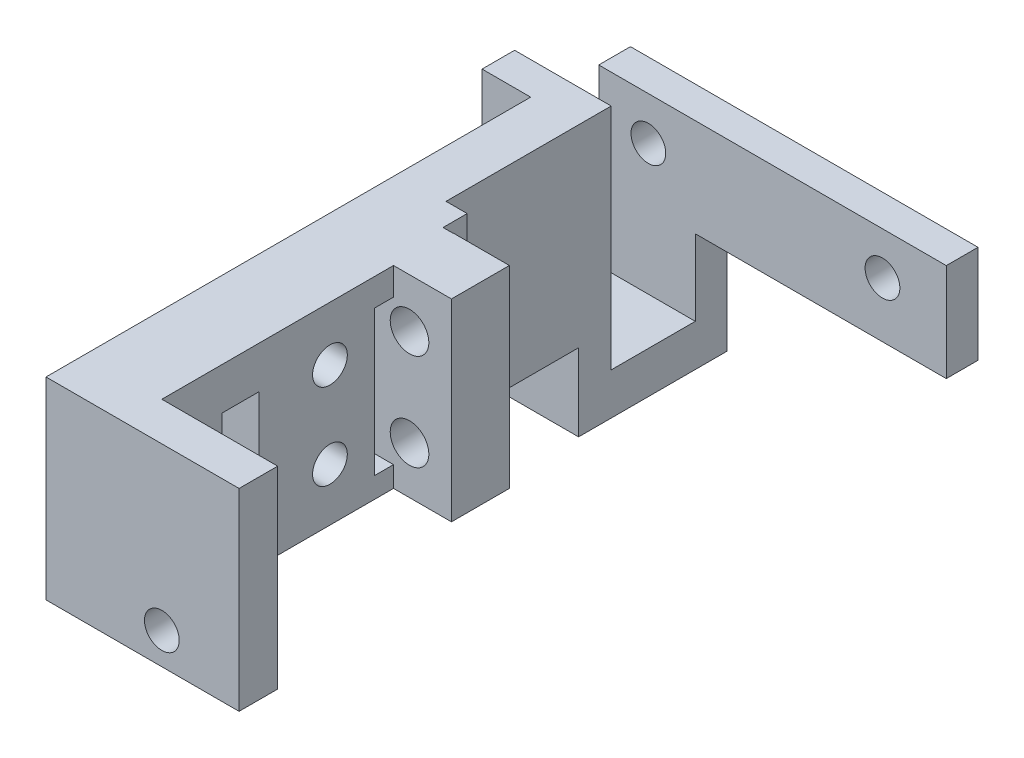
from build123d import *

# Parameters (mm, degrees)
BOSS_EXTRUDE1_DEPTH      = 20
CUT_EXTRUDE1_DEPTH       = 20
SKETCH3_W                = 42.504801082
SKETCH3_H                = 61.271071749
CUT_EXTRUDE2_DEPTH       = 7
BOSS_EXTRUDE3_DEPTH      = 8
BOSS_EXTRUDE3_DEPTH_BACK = 20
SKETCH5_W                = 10
SKETCH5_H                = 3.373015501
SKETCH6_R                = 2
CUT_EXTRUDE3_DEPTH       = 6
SKETCH7_W                = 10
SKETCH7_H                = 4.325701587
BOSS_EXTRUDE4_DEPTH      = 12
SKETCH8_W                = 10
SKETCH8_H                = 3.285099304
BOSS_EXTRUDE5_DEPTH      = 18
SKETCH9_R                = 1.8
CUT_EXTRUDE4_DEPTH       = 20
SKETCH10_W               = 4.6581603
SKETCH10_H               = 5.7
CUT_EXTRUDE5_DEPTH       = 3
SKETCH12_R               = 1.8
CUT_EXTRUDE7_DEPTH       = 5
SKETCH13_R               = 1.8
CUT_EXTRUDE8_DEPTH       = 12
SKETCH14_W               = 3.285099304
SKETCH14_H               = 10.140693855
BOSS_EXTRUDE6_DEPTH      = 26
SKETCH15_R               = 1.8
CUT_EXTRUDE9_DEPTH       = 20
SKETCH16_W               = 1.97268601
SKETCH16_H               = 15.028302634
CUT_EXTRUDE10_DEPTH      = 2
SKETCH18_W               = 3.824807143
SKETCH18_H               = 10.692395384
CUT_EXTRUDE11_DEPTH      = 10


with BuildPart() as part:
    # Sketch1 → Boss-Extrude1 (new body)
    with BuildSketch(Plane(origin=(0, 0, 0), x_dir=(1, 0, 0), z_dir=(0, 1, 0))):
        Polygon((8, 0), (0, 0), (0, -60.58), (20, -60.58), (20, -56.58), (8, -56.58), (8, -32.58), (14, -32.58), (14, -26.58), (8, -26.58), align=None)
    extrude(amount=BOSS_EXTRUDE1_DEPTH)

    # Sketch2 → Cut-Extrude1 (cut)
    with BuildSketch(Plane(origin=(0, 0, 0), x_dir=(-1, 0, 0), z_dir=(0, -1, 0))):
        Polygon((-8, 0), (-8, -26.58), (-8.155800491, -26.58), (-8.155800491, -26.605830214), (-7.155800491, -26.605830214), (-7.155800491, -24.105830214), (-4.963777836, -24.105830214), (-4.963777836, 0), align=None)
    extrude(amount=-CUT_EXTRUDE1_DEPTH, mode=Mode.SUBTRACT)

    # Sketch3 → Cut-Extrude2 (cut)
    with BuildSketch(Plane(origin=(0, 0, 0), x_dir=(-1, 0, 0), z_dir=(0, 0, -1))):
        with Locations((-1.640387793, 8.242348963)):
            Rectangle(SKETCH3_W, SKETCH3_H)
    extrude(amount=-CUT_EXTRUDE2_DEPTH, mode=Mode.SUBTRACT)

    # Sketch5 → Boss-Extrude3 (add, two sides: drawn at the far end of the back side and taken through both)
    with BuildSketch(Plane(origin=(0, 0, 0), x_dir=(-1, 0, 0), z_dir=(0, -1, 0)).offset(-BOSS_EXTRUDE3_DEPTH_BACK)):
        with Locations((0.036222164, -8.686507751)):
            Rectangle(SKETCH5_W, SKETCH5_H)
    extrude(amount=BOSS_EXTRUDE3_DEPTH + BOSS_EXTRUDE3_DEPTH_BACK)

    # Sketch6 → Cut-Extrude3 (cut)
    with BuildSketch(Plane(origin=(0, 0, 26.58), x_dir=(-1, 0, 0), z_dir=(0, 0, -1))):
        with Locations((-9.655800491, 4.904630263)):
            Circle(SKETCH6_R)
        with Locations((-9.655800491, 14.904630263)):
            Circle(SKETCH6_R)
    extrude(amount=-CUT_EXTRUDE3_DEPTH, mode=Mode.SUBTRACT)

    # Sketch7 → Boss-Extrude4 (add)
    with BuildSketch(Plane(origin=(0, 0, 7), x_dir=(-1, 0, 0), z_dir=(0, 0, -1))):
        with Locations((0.036222164, -5.837149207)):
            Rectangle(SKETCH7_W, SKETCH7_H)
    extrude(amount=BOSS_EXTRUDE4_DEPTH)

    # Sketch8 → Boss-Extrude5 (add)
    with BuildSketch(Plane(origin=(0, -3.674298413, 0), x_dir=(1, 0, 0), z_dir=(0, 1, 0))):
        with Locations((-0.036222164, 3.357450348)):
            Rectangle(SKETCH8_W, SKETCH8_H)
    extrude(amount=BOSS_EXTRUDE5_DEPTH)

    # Sketch9 → Cut-Extrude4 (cut)
    with BuildSketch(Plane(origin=(0, 0, -5), x_dir=(-1, 0, 0), z_dir=(0, 0, -1))):
        with Locations((-0.102745826, 9.860584284)):
            Circle(SKETCH9_R)
    extrude(amount=-CUT_EXTRUDE4_DEPTH, mode=Mode.SUBTRACT)

    # Sketch10 → Cut-Extrude5 (cut)
    with BuildSketch(Plane.ZY):
        with Locations((12.702095651, 9.85)):
            Rectangle(SKETCH10_W, SKETCH10_H)
    extrude(amount=-CUT_EXTRUDE5_DEPTH, mode=Mode.SUBTRACT)

    # Sketch12 → Cut-Extrude7 (cut)
    with BuildSketch(Plane.XY.offset(60.58)):
        with Locations((12, 3.26546718)):
            Circle(SKETCH12_R)
    extrude(amount=-CUT_EXTRUDE7_DEPTH, mode=Mode.SUBTRACT)

    # Sketch13 → Cut-Extrude8 (cut)
    with BuildSketch(Plane.ZY):
        with Locations((39.167156573, 5.468808009)):
            Circle(SKETCH13_R)
        with Locations((39.167156573, 14.370824603)):
            Circle(SKETCH13_R)
    extrude(amount=-CUT_EXTRUDE8_DEPTH, mode=Mode.SUBTRACT)

    # Sketch14 → Boss-Extrude6 (add)
    with BuildSketch(Plane(origin=(4.963777836, 0, 0), x_dir=(0, 0, -1), z_dir=(1, 0, 0))):
        with Locations((3.357450348, 9.25535466)):
            Rectangle(SKETCH14_W, SKETCH14_H)
    extrude(amount=BOSS_EXTRUDE6_DEPTH)

    # Sketch15 → Cut-Extrude9 (cut)
    with BuildSketch(Plane(origin=(0, 0, -5), x_dir=(-1, 0, 0), z_dir=(0, 0, -1))):
        with Locations((-24.353207193, 9.904630263)):
            Circle(SKETCH15_R)
    extrude(amount=-CUT_EXTRUDE9_DEPTH, mode=Mode.SUBTRACT)

    # Sketch16 → Cut-Extrude10 (cut)
    with BuildSketch(Plane(origin=(8, 0, 0), x_dir=(0, 0, -1), z_dir=(1, 0, 0))):
        with Locations((-33.566343005, 9.65070179)):
            Rectangle(SKETCH16_W, SKETCH16_H)
    extrude(amount=-CUT_EXTRUDE10_DEPTH, mode=Mode.SUBTRACT)

    # Sketch18 → Cut-Extrude11 (cut)
    with BuildSketch(Plane.ZY):
        with Locations((48.45250386, 10.297450391)):
            Rectangle(SKETCH18_W, SKETCH18_H)
    extrude(amount=-CUT_EXTRUDE11_DEPTH, mode=Mode.SUBTRACT)


solid = part.part
